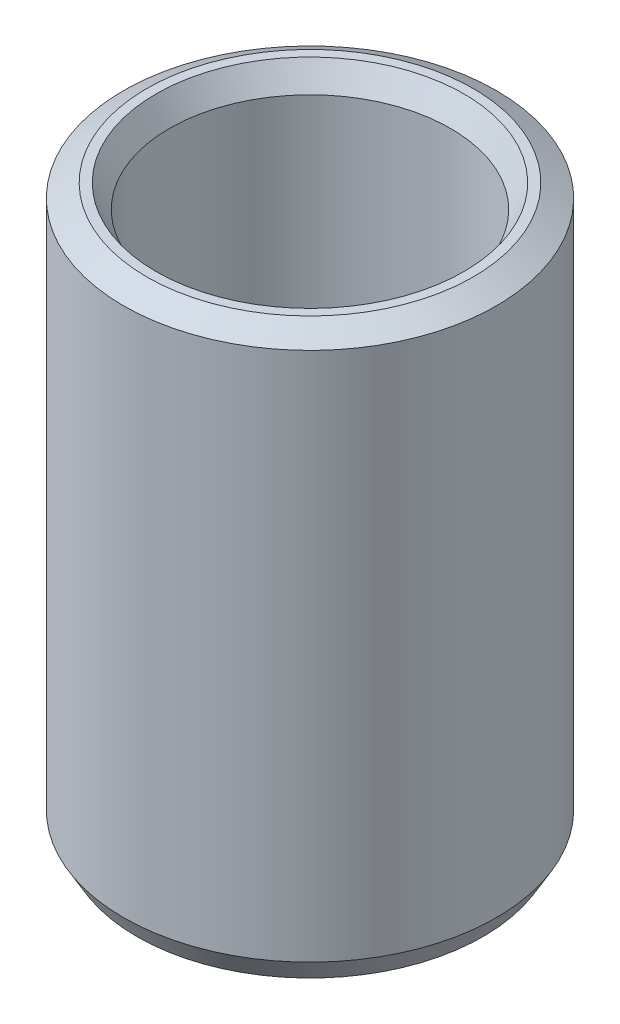
from build123d import *
from OCP.BRepFilletAPI import BRepFilletAPI_MakeChamfer

# Parameters (mm, degrees)
SKETCH1_R           = 27.5
BOSS_EXTRUDE1_DEPTH = 83.547628829
SKETCH2_R           = 20.730776711
CUT_EXTRUDE1_DEPTH  = 93.155880349
CHAMFER1_SIZE       = 1.976044405
CHAMFER1_SIZE2      = 3.422609308


with BuildPart() as part:
    # Sketch1 → Boss-Extrude1 (new body)
    with BuildSketch(Plane(origin=(0, 0, 0), x_dir=(1, 0, 0), z_dir=(0, 1, 0))):
        Circle(SKETCH1_R)
    extrude(amount=BOSS_EXTRUDE1_DEPTH)

    # Sketch2 → Cut-Extrude1 (cut, through all)
    with BuildSketch(Plane(origin=(0, 0, 0), x_dir=(1, 0, 0), z_dir=(0, 1, 0))):
        Circle(SKETCH2_R)
    extrude(amount=CUT_EXTRUDE1_DEPTH, mode=Mode.SUBTRACT)

    # Chamfer1: one chamfer whose edges measure the first distance from different faces: ONE call of the kernel's chamfer builder (chamfer() names one face for all edges)
    chamfer1_edges_1 = [part.edges().sort_by_distance(p)[0] for p in [
        (-20.730776711, 83.547628829, 0),
    ]]
    chamfer1_side_1 = [part.faces().sort_by_distance(p)[0] for p in [
        (-26.722182541, 83.547628829, 0),
    ]]
    chamfer1_edges_2 = [part.edges().sort_by_distance(p)[0] for p in [
        (-20.730776711, 0, 0),
    ]]
    chamfer1_side_2 = [part.faces().sort_by_distance(p)[0] for p in [
        (-20.730776711, 41.773814414, 0),
    ]]
    chamfer1_edges_3 = [part.edges().sort_by_distance(p)[0] for p in [
        (-27.5, 0, 0),
    ]]
    chamfer1_side_3 = [part.faces().sort_by_distance(p)[0] for p in [
        (-26.722182541, 0, 0),
    ]]
    chamfer1_edges_4 = [part.edges().sort_by_distance(p)[0] for p in [
        (-27.5, 83.547628829, 0),
    ]]
    chamfer1_side_4 = [part.faces().sort_by_distance(p)[0] for p in [
        (-27.5, 41.773814414, 0),
    ]]
    chamfer1 = BRepFilletAPI_MakeChamfer(part.part.solid().wrapped)
    for e in chamfer1_edges_1:
        chamfer1.Add(CHAMFER1_SIZE, CHAMFER1_SIZE2, e.wrapped, chamfer1_side_1[0].wrapped)  # the first distance lies on this face
    for e in chamfer1_edges_2:
        chamfer1.Add(CHAMFER1_SIZE, CHAMFER1_SIZE2, e.wrapped, chamfer1_side_2[0].wrapped)  # the first distance lies on this face
    for e in chamfer1_edges_3:
        chamfer1.Add(CHAMFER1_SIZE, CHAMFER1_SIZE2, e.wrapped, chamfer1_side_3[0].wrapped)  # the first distance lies on this face
    for e in chamfer1_edges_4:
        chamfer1.Add(CHAMFER1_SIZE, CHAMFER1_SIZE2, e.wrapped, chamfer1_side_4[0].wrapped)  # the first distance lies on this face
    add(Compound.cast(chamfer1.Shape()), mode=Mode.REPLACE)


solid = part.part
